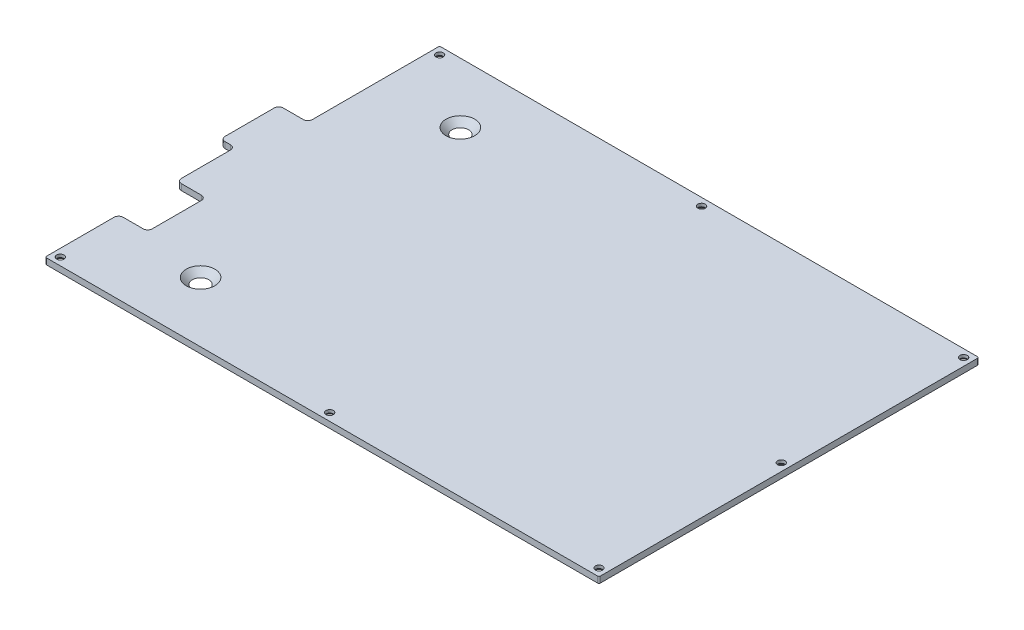
from build123d import *

# Parameters (mm, degrees)
PLATE_FRAME_DEPTH                              = 2
CSK_FOR_M2_FLAT_HEAD_MACHINE_SCREW1_AT_2_COUNT = 2
CSK_FOR_M2_FLAT_HEAD_MACHINE_SCREW1_AT_2_PITCH = 88.10625
CSK_FOR_M2_FLAT_HEAD_MACHINE_SCREW1_AT_3_COUNT = 2
CSK_FOR_M2_FLAT_HEAD_MACHINE_SCREW1_AT_3_PITCH = 176.2125
CSK_FOR_M2_FLAT_HEAD_MACHINE_SCREW1_AT_4_COUNT = 2
CSK_FOR_M2_FLAT_HEAD_MACHINE_SCREW1_AT_4_PITCH = 186.034856025
CSK_FOR_M2_FLAT_HEAD_MACHINE_SCREW1_AT_5_COUNT = 2
CSK_FOR_M2_FLAT_HEAD_MACHINE_SCREW1_AT_5_PITCH = 212.798813804
CSK_FOR_M2_FLAT_HEAD_MACHINE_SCREW1_AT_6_COUNT = 2
CSK_FOR_M2_FLAT_HEAD_MACHINE_SCREW1_AT_6_PITCH = 149.734690891
CSK_FOR_M2_FLAT_HEAD_MACHINE_SCREW1_AT_7_COUNT = 2
CSK_FOR_M2_FLAT_HEAD_MACHINE_SCREW1_AT_7_PITCH = 119.395022535
CSK_FOR_M4_FLAT_HEAD_MACHINE_SCREW1_AT_2_COUNT = 2
CSK_FOR_M4_FLAT_HEAD_MACHINE_SCREW1_AT_2_PITCH = 85
FILLET1_R                                      = 1.5
FILLET2_R                                      = 0.5


with BuildPart() as part:
    # Sketch1 → Plate Frame (new body)
    with BuildSketch(Plane(origin=(0, 0, 0), x_dir=(1, 0, 0), z_dir=(0, 1, 0))):
        Polygon((0, 0), (0, 124.3), (-176.45, 124.3), (-176.45, 81.2), (-185.975, 81.2), (-185.975, 62.15), (-181.2125, 62.15), (-181.2125, 43.1), (-171.6875, 43.1), (-171.6875, 24.05), (-181.2125, 24.05), (-181.2125, 0), align=None)
    extrude(amount=PLATE_FRAME_DEPTH)

    # Sketch4 → CSK for M2 Flat Head Machine Screw1 (revolve, cut)
    with BuildSketch(Plane(origin=(-178.7125, 0, -2.5), x_dir=(0, 0, -1), z_dir=(1, 0, 0))):
        Polygon((0, 0), (0, 2), (1.2, 2), (1.2, 1), (2.2, 0), align=None)
    csk_for_m2_flat_head_machine_screw1 = revolve(axis=Axis((-178.7125, -6.35, -2.5), (0, 1, 0)), mode=Mode.SUBTRACT)

    # CSK for M2 Flat Head Machine Screw1 at 2: CSK for M2 Flat Head Machine Screw1 ×2
    with Locations(*[(i * CSK_FOR_M2_FLAT_HEAD_MACHINE_SCREW1_AT_2_PITCH, 0, 0) for i in range(1, CSK_FOR_M2_FLAT_HEAD_MACHINE_SCREW1_AT_2_COUNT)]):
        add(csk_for_m2_flat_head_machine_screw1, mode=Mode.SUBTRACT)

    # CSK for M2 Flat Head Machine Screw1 at 3: CSK for M2 Flat Head Machine Screw1 ×2
    with Locations(*[(i * CSK_FOR_M2_FLAT_HEAD_MACHINE_SCREW1_AT_3_PITCH, 0, 0) for i in range(1, CSK_FOR_M2_FLAT_HEAD_MACHINE_SCREW1_AT_3_COUNT)]):
        add(csk_for_m2_flat_head_machine_screw1, mode=Mode.SUBTRACT)

    # CSK for M2 Flat Head Machine Screw1 at 4: CSK for M2 Flat Head Machine Screw1 ×2
    with Locations(*[Vector(0.9472015286011822, 0, -0.32063883765942) * (i * CSK_FOR_M2_FLAT_HEAD_MACHINE_SCREW1_AT_4_PITCH) for i in range(1, CSK_FOR_M2_FLAT_HEAD_MACHINE_SCREW1_AT_4_COUNT)]):
        add(csk_for_m2_flat_head_machine_screw1, mode=Mode.SUBTRACT)

    # CSK for M2 Flat Head Machine Screw1 at 5: CSK for M2 Flat Head Machine Screw1 ×2
    with Locations(*[Vector(0.828070875256726, 0, -0.5606234257962825) * (i * CSK_FOR_M2_FLAT_HEAD_MACHINE_SCREW1_AT_5_PITCH) for i in range(1, CSK_FOR_M2_FLAT_HEAD_MACHINE_SCREW1_AT_5_COUNT)]):
        add(csk_for_m2_flat_head_machine_screw1, mode=Mode.SUBTRACT)

    # CSK for M2 Flat Head Machine Screw1 at 6: CSK for M2 Flat Head Machine Screw1 ×2
    with Locations(*[Vector(0.6043188753487788, 0, -0.7967425537130468) * (i * CSK_FOR_M2_FLAT_HEAD_MACHINE_SCREW1_AT_6_PITCH) for i in range(1, CSK_FOR_M2_FLAT_HEAD_MACHINE_SCREW1_AT_6_COUNT)]):
        add(csk_for_m2_flat_head_machine_screw1, mode=Mode.SUBTRACT)

    # CSK for M2 Flat Head Machine Screw1 at 7: CSK for M2 Flat Head Machine Screw1 ×2
    with Locations(*[Vector(0.03988859752159598, 0, -0.9992041331918919) * (i * CSK_FOR_M2_FLAT_HEAD_MACHINE_SCREW1_AT_7_PITCH) for i in range(1, CSK_FOR_M2_FLAT_HEAD_MACHINE_SCREW1_AT_7_COUNT)]):
        add(csk_for_m2_flat_head_machine_screw1, mode=Mode.SUBTRACT)

    # Sketch7 → CSK for M4 Flat Head Machine Screw1 (revolve, cut)
    with BuildSketch(Plane(origin=(-150, 2, -104.65), x_dir=(0, 0, 1), z_dir=(1, 0, 0))):
        Polygon((0, 0), (0, 2), (2.25, 2), (2.25, 2.45), (4.7, 0), align=None)
    csk_for_m4_flat_head_machine_screw1 = revolve(axis=Axis((-150, 8.35, -104.65), (0, -1, 0)), mode=Mode.SUBTRACT)

    # CSK for M4 Flat Head Machine Screw1 at 2: CSK for M4 Flat Head Machine Screw1 ×2
    with Locations(*[(0, 0, i * CSK_FOR_M4_FLAT_HEAD_MACHINE_SCREW1_AT_2_PITCH) for i in range(1, CSK_FOR_M4_FLAT_HEAD_MACHINE_SCREW1_AT_2_COUNT)]):
        add(csk_for_m4_flat_head_machine_screw1, mode=Mode.SUBTRACT)

    # Fillet1
    fillet1_edges = [part.edges().sort_by_distance(p)[0] for p in [
        (-171.6875, 1, -24.05),
        (-181.2125, 1, -24.05),
        (-171.6875, 1, -43.1),
        (-181.2125, 1, -62.15),
        (-181.2125, 1, -43.1),
        (-185.975, 1, -62.15),
        (-185.975, 1, -81.2),
        (-176.45, 1, -81.2),
    ]]
    fillet(fillet1_edges, radius=FILLET1_R)

    # Fillet2
    fillet2_edges = [part.edges().sort_by_distance(p)[0] for p in [
        (-176.45, 1, -124.3),
        (-181.2125, 1, 0),
        (0, 1, -124.3),
        (0, 1, 0),
    ]]
    fillet(fillet2_edges, radius=FILLET2_R)


solid = part.part
